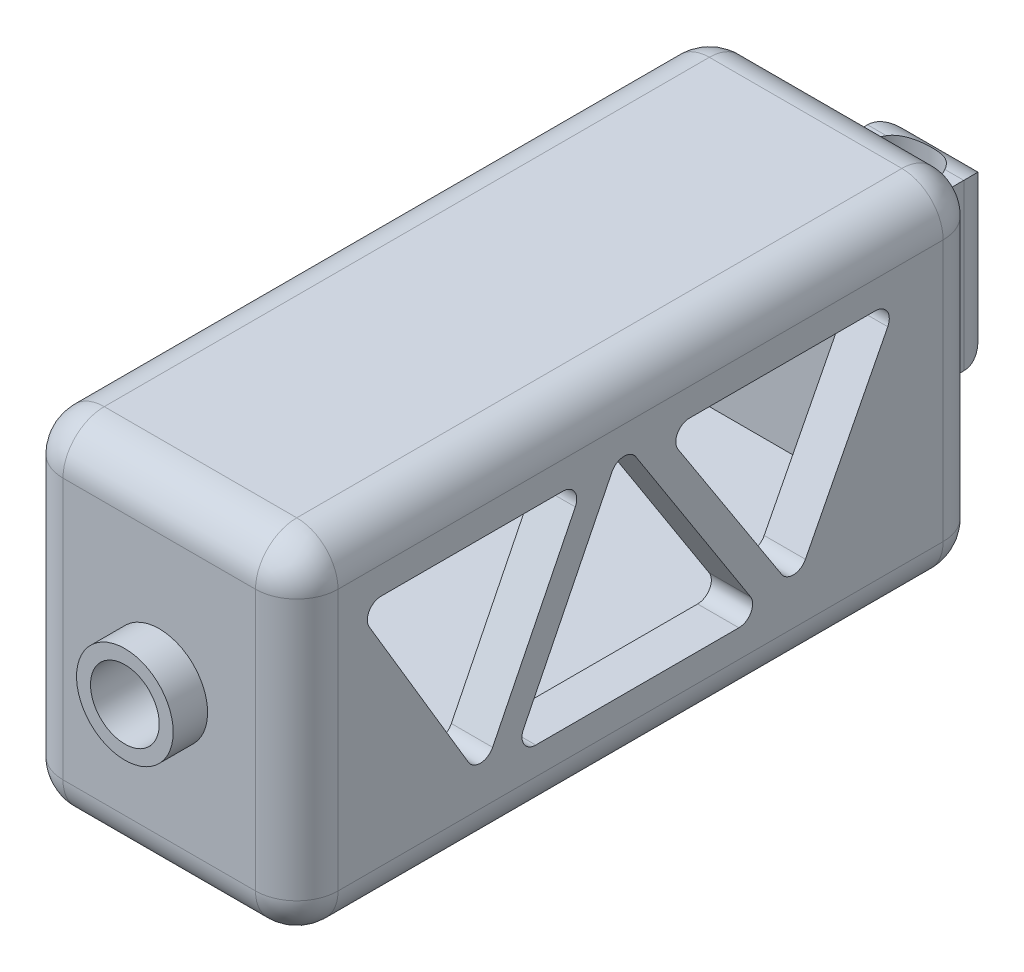
from build123d import *

# Parameters (mm, degrees)
SKETCH1_W           = 100
SKETCH1_H           = 50
BOSS_EXTRUDE1_DEPTH = 40
FILLET1_R           = 6
SKETCH4_R           = 5
CUT_EXTRUDE2_DEPTH  = 8
CUT_EXTRUDE4_DEPTH  = 69.738635424
SKETCH29_W          = 14
SKETCH29_H          = 24
BOSS_EXTRUDE2_DEPTH = 15
SKETCH31_R          = 4.938293982
CUT_EXTRUDE6_DEPTH  = 85.817451035
FILLET7_R           = 5
SKETCH32_W          = 28
SKETCH32_H          = 38
CUT_EXTRUDE7_DEPTH  = 88
BOSS_EXTRUDE3_START = 5
SKETCH33_R          = 7.029692419
SKETCH33_R_2        = 5
BOSS_EXTRUDE3_DEPTH = 5


with BuildPart() as part:
    # Sketch1 → Boss-Extrude1 (new body)
    with BuildSketch(Plane(origin=(0, 0, 0), x_dir=(0, 0, -1), z_dir=(1, 0, 0))):
        Rectangle(SKETCH1_W, SKETCH1_H)
    extrude(amount=BOSS_EXTRUDE1_DEPTH)

    # Fillet1
    fillet1_edges = [part.edges().sort_by_distance(p)[0] for p in [
        (40, 0, 50),
        (40, -25, 0),
        (40, 0, -50),
        (0, -25, 0),
        (0, 0, 50),
        (0, 25, 0),
        (0, 0, -50),
        (20, -25, -50),
        (20, -25, 50),
        (20, 25, 50),
        (20, 25, -50),
        (40, 25, 0),
    ]]
    fillet(fillet1_edges, radius=FILLET1_R)

    # Sketch4 → Cut-Extrude2 (cut)
    with BuildSketch(Plane.XY.offset(50)):
        with Locations((20, 0)):
            Circle(SKETCH4_R)
    extrude(amount=-CUT_EXTRUDE2_DEPTH, mode=Mode.SUBTRACT)

    # Sketch27 → Cut-Extrude4 (cut, through all)
    with BuildSketch(Plane.ZY):
        with BuildLine():
            Line((-35.948740213, 12.085727651), (-23.973812043, -11.212498079))
            ThreePointArc((-23.973812043, -11.212498079), (-22.294505165, -12.295749804), (-20.515873253, -11.384720489))
            Line((-20.515873253, -11.384720489), (-5.440704193, 11.91350524))
            ThreePointArc((-5.440704193, 11.91350524), (-5.363007282, 13.955774681), (-7.119849552, 15))
            Line((-7.119849552, 15), (-34.169946782, 15))
            ThreePointArc((-34.169946782, 15), (-35.877070781, 14.041982558), (-35.948740213, 12.085727651))
        make_face()
        with BuildLine():
            Line((4.169016264, 13.839458065), (17.035163046, -12.111620565))
            ThreePointArc((17.035163046, -12.111620565), (16.94282084, -14.054334181), (15.243297544, -15))
            Line((15.243297544, -15), (-14.291999001, -15))
            ThreePointArc((-14.291999001, -15), (-16.047244937, -13.958703137), (-15.974758786, -11.919111705))
            Line((-15.974758786, -11.919111705), (0.699377924, 14.039691649))
            ThreePointArc((0.699377924, 14.039691649), (2.492379474, 14.947756457), (4.169016264, 13.839458065))
        make_face()
        with BuildLine():
            Line((9.490272401, 12.111620565), (21.518065714, -12.148495172))
            ThreePointArc((21.518065714, -12.148495172), (23.233716027, -13.258663021), (25.028933638, -12.282383156))
            Line((25.028933638, -12.282383156), (39.456095343, 11.977732581))
            ThreePointArc((39.456095343, 11.977732581), (39.475559896, 13.988803611), (37.737092922, 15))
            Line((37.737092922, 15), (11.282137904, 15))
            ThreePointArc((11.282137904, 15), (9.582614607, 14.054334181), (9.490272401, 12.111620565))
        make_face()
    extrude(amount=-CUT_EXTRUDE4_DEPTH, mode=Mode.SUBTRACT)

    # Sketch29 → Boss-Extrude2 (add)
    with BuildSketch(Plane(origin=(0, 0, -50), x_dir=(-1, 0, 0), z_dir=(0, 0, -1))):
        with Locations((-20, 0)):
            Rectangle(SKETCH29_W, SKETCH29_H)
    extrude(amount=BOSS_EXTRUDE2_DEPTH)

    # Sketch31 → Cut-Extrude6 (cut, through all)
    with BuildSketch(Plane.XZ.offset(12)):
        with Locations(Location((20, -57.5, 0), (0, 0, 270))):
            Circle(SKETCH31_R)
    extrude(amount=-CUT_EXTRUDE6_DEPTH, mode=Mode.SUBTRACT)

    # Fillet7
    # the kernel refuses this fillet: 5 mm, written as the material it takes off along each edge
    with BuildSketch(Plane(origin=(13, 24.5, -65), x_dir=(0, 0, 1), z_dir=(0, -1, 0)), Plane(origin=(27, -24.5, -65), x_dir=(0, 0, 1), z_dir=(0, 1, 0))) as fillet7_piece_1:
        with BuildLine():
            CenterArc((FILLET7_R, -FILLET7_R), FILLET7_R, 90, 90)
            Line((0, -FILLET7_R), (0, 0))
            Line((0, 0), (FILLET7_R, 0))
        make_face()
    extrude(amount=49, mode=Mode.SUBTRACT)
    with BuildSketch(Plane(origin=(39.5, 12, -65), x_dir=(0, 0, 1), z_dir=(-1, 0, 0)), Plane(origin=(0.5, -12, -65), x_dir=(0, 0, 1), z_dir=(1, 0, 0))) as fillet7_piece_2:
        with BuildLine():
            CenterArc((FILLET7_R, -FILLET7_R), FILLET7_R, 90, 90)
            Line((0, -FILLET7_R), (0, 0))
            Line((0, 0), (FILLET7_R, 0))
        make_face()
    extrude(amount=39, mode=Mode.SUBTRACT)

    # Sketch32 → Cut-Extrude7 (cut)
    with BuildSketch(Plane.XY.offset(44)):
        with Locations((20, 0)):
            Rectangle(SKETCH32_W, SKETCH32_H)
    extrude(amount=-CUT_EXTRUDE7_DEPTH, mode=Mode.SUBTRACT)

    # Sketch33 → Boss-Extrude3 (add)
    with BuildSketch(Plane.XY.offset(50).offset(BOSS_EXTRUDE3_START)):
        with Locations(Location((20, 0, 0), (0, 0, 90))):
            Circle(SKETCH33_R)
        with Locations((20, 0)):
            Circle(SKETCH33_R_2, mode=Mode.SUBTRACT)
    extrude(amount=-BOSS_EXTRUDE3_DEPTH)


solid = part.part
